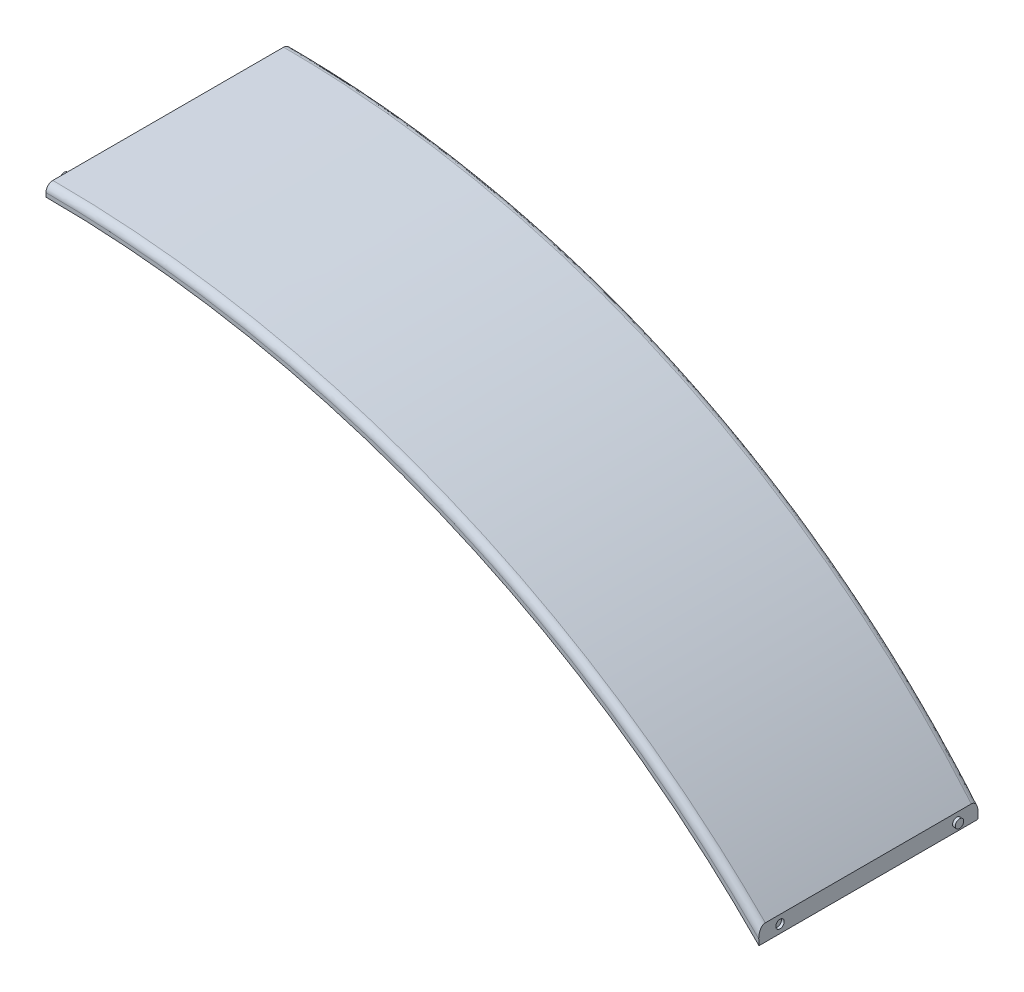
from build123d import *

# Parameters (mm, degrees)
BOSS_EXTRUDE1_DEPTH            = 22.225
CUT_EXTRUDE1_REACH             = 331.298
SKETCH2_R                      = 4.7625
CUT_EXTRUDE1_DIRECTION_2_REACH = 331.298
CUT_EXTRUDE2_DEPTH             = 254
FILLET1_R                      = 12.7
FILLET4_R                      = 1.2446
F_1_4_CLEARANCE_HOLE1_D        = 6.5278
F_1_4_CLEARANCE_HOLE1_DEPTH    = 6.35
F_1_4_CLEARANCE_HOLE1_TIP      = 1.961148974
SKETCH8_W                      = 63.920753762
SKETCH8_H                      = 259.326964074
CUT_EXTRUDE6_DEPTH             = 480.06
SKETCH9_W                      = 88.100911174
SKETCH9_H                      = 283.825810454
CUT_EXTRUDE7_DEPTH             = 480.06
SKETCH10_R                     = 0.762
BOSS_EXTRUDE2_DEPTH            = 0.508
SKETCH11_R                     = 0.762
CUT_EXTRUDE8_DEPTH             = 0.508
SKETCH12_R                     = 0.762
CUT_EXTRUDE9_DEPTH             = 0.508
SKETCH13_R                     = 0.762
BOSS_EXTRUDE3_DEPTH            = 0.508


with BuildPart() as part:
    # Sketch1 → Boss-Extrude1 (new, symmetric)
    with BuildSketch(Plane.XY):
        with BuildLine():
            add(Edge.make_bspline(
                [(247.65, 12.7), (247.65, 151.138652105), (159.851901214, 215.9), (69.85, 215.9)],
                knots=[0, 0, 0, 0, 1, 1, 1, 1], degree=3))
            Line((69.85, 215.9), (-69.85, 215.9))
            add(Edge.make_bspline(
                [(-69.85, 215.9), (-159.851901214, 215.9), (-247.65, 151.138652105), (-247.65, 12.7)],
                knots=[0, 0, 0, 0, 1, 1, 1, 1], degree=3))
            Line((-247.65, 12.7), (-247.65, -12.7))
            Line((-247.65, -12.7), (-245.618, -12.7))
            Line((-245.618, -12.7), (-245.618, 12.7))
            add(Edge.make_bspline(
                [(-69.85, 213.868), (-75.40386678, 213.868), (-86.529134162, 213.367524052), (-108.503296863, 210.348405687), (-135.224023579, 202.760511588), (-165.078062417, 187.457160851), (-187.304904565, 169.454437631), (-203.008125467, 151.842675097), (-213.624406237, 137.012147223), (-222.956422719, 120.542434531), (-230.879834274, 102.41559311), (-237.26896978, 82.613605898), (-241.209008074, 64.702111997), (-243.466672055, 49.517673174), (-244.696729955, 37.702743517), (-245.322441099, 27.489835839), (-245.575395866, 19.120958406), (-245.618, 14.831688899), (-245.618, 12.7)],
                knots=[0, 0, 0, 0, 0.0625, 0.125, 0.25, 0.375, 0.5, 0.5625, 0.625, 0.6875, 0.75, 0.8125, 0.875, 0.90625, 0.9375, 0.96875, 0.984375, 1, 1, 1, 1], degree=3))
            Line((-69.85, 213.868), (69.85, 213.868))
            add(Edge.make_bspline(
                [(245.618, 12.7), (245.618, 14.831688899), (245.575395866, 19.120958406), (245.322441099, 27.489835839), (244.696729955, 37.702743517), (243.466672055, 49.517673174), (241.209008074, 64.702111997), (237.26896978, 82.613605898), (230.879834274, 102.41559311), (222.956422719, 120.542434531), (213.624406237, 137.012147223), (203.008125467, 151.842675097), (187.304904565, 169.454437631), (165.078062417, 187.457160851), (135.224023579, 202.760511588), (108.503296863, 210.348405687), (86.529134162, 213.367524052), (75.40386678, 213.868), (69.85, 213.868)],
                knots=[0, 0, 0, 0, 0.015625, 0.03125, 0.0625, 0.09375, 0.125, 0.1875, 0.25, 0.3125, 0.375, 0.4375, 0.5, 0.625, 0.75, 0.875, 0.9375, 1, 1, 1, 1], degree=3))
            Line((245.618, 12.7), (245.618, -12.7))
            Line((245.618, -12.7), (247.65, -12.7))
            Line((247.65, -12.7), (247.65, 12.7))
        make_face()
    extrude(amount=BOSS_EXTRUDE1_DEPTH, both=True)

    # Sketch2 → Cut-Extrude1 (cut, up to next)
    with BuildSketch(Plane(origin=(0, 0, 0), x_dir=(0, 0, -1), z_dir=(1, 0, 0)), mode=Mode.PRIVATE) as cut_extrude1_sk1:
        Circle(SKETCH2_R)
    cut_extrude1_tool1 = extrude(cut_extrude1_sk1.sketch, amount=-CUT_EXTRUDE1_REACH, mode=Mode.PRIVATE) & part.part
    add(cut_extrude1_tool1.solids().sort_by_distance((0, 0, 0))[0], mode=Mode.SUBTRACT)

    # Sketch2 → Cut-Extrude1 direction 2 (cut, up to next)
    with BuildSketch(Plane(origin=(0, 0, 0), x_dir=(0, 0, -1), z_dir=(1, 0, 0)), mode=Mode.PRIVATE) as cut_extrude1_direction_2_sk1:
        Circle(SKETCH2_R)
    cut_extrude1_direction_2_tool1 = extrude(cut_extrude1_direction_2_sk1.sketch, amount=CUT_EXTRUDE1_DIRECTION_2_REACH, mode=Mode.PRIVATE) & part.part
    add(cut_extrude1_direction_2_tool1.solids().sort_by_distance((0, 0, 0))[0], mode=Mode.SUBTRACT)

    # Sketch3 → Cut-Extrude2 (cut, symmetric)
    with BuildSketch(Plane(origin=(0, 0, 0), x_dir=(0, 0, -1), z_dir=(1, 0, 0))):
        Polygon((-22.225, 215.9), (-12.7, -12.7), (-47.625, -12.7), (-47.625, 215.9), align=None)
        Polygon((22.225, 215.9), (12.7, -12.7), (47.625, -12.7), (47.625, 215.9), align=None)
    extrude(amount=CUT_EXTRUDE2_DEPTH, both=True, mode=Mode.SUBTRACT)

    # Fillet1
    fillet1_edges = [part.edges().sort_by_distance(p)[0] for p in [
        (-246.634, -12.7, -12.7),
        (-246.634, -12.7, 12.7),
        (246.634, -12.7, -12.7),
        (246.634, -12.7, 12.7),
    ]]
    fillet(fillet1_edges, radius=FILLET1_R)

    # Fillet4
    fillet4_edges = [part.edges().sort_by_distance(p)[0] for p in [
        (247.65, -9.165276607, -9.309489742),
        (247.65, 6.085646041, -13.482735252),
        (-247.65, -9.165276607, -9.309489742),
        (-247.65, 6.085646041, -13.482735252),
        (247.65, -9.165276607, 9.309489742),
        (247.65, 6.085646041, 13.482735252),
        (-247.65, -9.165276607, 9.309489742),
        (-247.65, 6.085646041, 13.482735252),
        (0, 215.9, 22.225),
        (-203.084938623, 154.469294773, 19.665387282),
        (-247.65, -12.7, 0),
        (-203.084938623, 154.469294773, -19.665387282),
        (0, 215.9, -22.225),
        (203.084938625, 154.469294774, -19.665387282),
        (247.65, -12.7, 0),
        (203.084938625, 154.469294774, 19.665387282),
    ]]
    fillet(fillet4_edges, radius=FILLET4_R)

    # 1/4 Clearance Hole1
    with Locations(Plane(origin=(5.734151724, 215.9, -6.658847299), x_dir=(1, 0, 0), z_dir=(0, 1, 0))):
        with Locations((35.540848276, -16.183847299), (35.540848276, 2.866152701), (-47.009151724, -16.183847299), (-47.009151724, 2.866152701)):
            Hole(F_1_4_CLEARANCE_HOLE1_D / 2, depth=F_1_4_CLEARANCE_HOLE1_DEPTH)
            with Locations((0, 0, -(F_1_4_CLEARANCE_HOLE1_DEPTH + F_1_4_CLEARANCE_HOLE1_TIP / 2))):  # 118° drill point
                Cone(0, F_1_4_CLEARANCE_HOLE1_D / 2, F_1_4_CLEARANCE_HOLE1_TIP, mode=Mode.SUBTRACT)

    # Sketch8 → Cut-Extrude6 (cut)
    with BuildSketch(Plane.ZY.offset(-196.85)):
        with Locations((0.135769602, 94.203521296)):
            Rectangle(SKETCH8_W, SKETCH8_H)
    extrude(amount=-CUT_EXTRUDE6_DEPTH, mode=Mode.SUBTRACT)

    # Sketch9 → Cut-Extrude7 (cut)
    with BuildSketch(Plane.ZY.offset(-69.85)):
        with Locations((-8.562615528, 81.40260027)):
            Rectangle(SKETCH9_W, SKETCH9_H)
    extrude(amount=CUT_EXTRUDE7_DEPTH, mode=Mode.SUBTRACT)

    # Sketch10 → Boss-Extrude2 (add)
    with BuildSketch(Plane(origin=(196.85, 0, 0), x_dir=(0, 0, -1), z_dir=(1, 0, 0))):
        with Locations((16.028769638, 160.132431528)):
            Circle(SKETCH10_R)
    extrude(amount=BOSS_EXTRUDE2_DEPTH)

    # Sketch11 → Cut-Extrude8 (cut)
    with BuildSketch(Plane(origin=(196.85, 0, 0), x_dir=(0, 0, -1), z_dir=(1, 0, 0))):
        with Locations((-16.028769638, 160.138450063)):
            Circle(SKETCH11_R)
    extrude(amount=-CUT_EXTRUDE8_DEPTH, mode=Mode.SUBTRACT)

    # Sketch12 → Cut-Extrude9 (cut)
    with BuildSketch(Plane.ZY.offset(-69.85)):
        with Locations((-18.330333333, 214.884)):
            Circle(SKETCH12_R)
    extrude(amount=-CUT_EXTRUDE9_DEPTH, mode=Mode.SUBTRACT)

    # Sketch13 → Boss-Extrude3 (add)
    with BuildSketch(Plane.ZY.offset(-69.85)):
        with Locations((18.330333333, 214.884)):
            Circle(SKETCH13_R)
    extrude(amount=BOSS_EXTRUDE3_DEPTH)


solid = part.part
